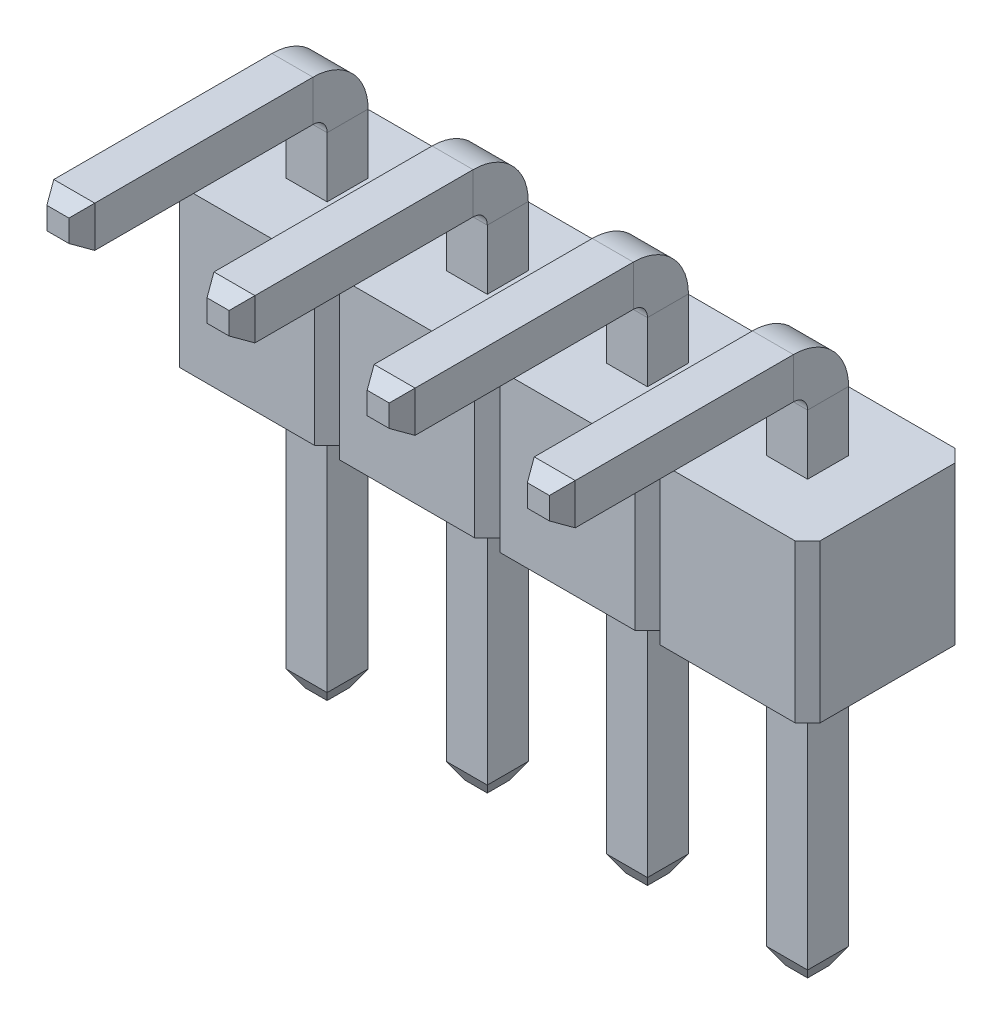
from build123d import *

# Parameters (mm, degrees)
BOSS_EXTRUDE1_DEPTH = 2.5
SKETCH3_W           = 0.65
SKETCH3_H           = 0.65
BOSS_EXTRUDE2_DEPTH = 6
SKETCH4_W           = 0.65
SKETCH4_H           = 0.65
CHAMFER3_SIZE       = 0.15
CHAMFER3_SIZE2      = 0.259807621
CHAMFER2_SIZE       = 0.15
CHAMFER2_SIZE2      = 0.259807621
LPATTERN2_START     = -5.08
LPATTERN2_OUTLINE_W = 2.5
LPATTERN2_OUTLINE_H = 2.54
LPATTERN2_DEPTH     = 7.62
LPATTERN2_START_2   = -4.135
LPATTERN2_2_DEPTH   = 0.65
LPATTERN2_START_3   = -1.595
LPATTERN2_3_DEPTH   = 0.65
LPATTERN2_START_4   = 0.945
LPATTERN2_4_DEPTH   = 0.65
LPATTERN2_START_5   = -4.240192379
LPATTERN2_5_DEPTH   = 9.240192379
LPATTERN2_START_6   = -1
LPATTERN2_6_DEPTH   = 2


with BuildPart() as part:
    # Sketch1 → Boss-Extrude1 (new body)
    with BuildSketch(Plane(origin=(0, 0, 0), x_dir=(1, 0, 0), z_dir=(0, 1, 0))):
        Polygon((-7.42, 1.27), (-7.62, 1.07), (-7.62, -1.07), (-7.42, -1.27), (-5.28, -1.27), (-5.08, -1.07), (-5.08, 1.07), (-5.28, 1.27), align=None)
    extrude(amount=BOSS_EXTRUDE1_DEPTH)

    # Sketch3 → Boss-Extrude2 (add)
    with BuildSketch(Plane(origin=(0, -4.5, 0), x_dir=(1, 0, 0), z_dir=(0, 1, 0))):
        with Locations((-6.35, 0)):
            Rectangle(SKETCH3_W, SKETCH3_H)
    extrude(amount=BOSS_EXTRUDE2_DEPTH)

    # Sweep1: sweep along a path in Sketch5
    with BuildLine(Plane.ZY.offset(6.35)) as sweep1_path:
        Line((0, 2.5), (0, 3.45))
        ThreePointArc((0, 3.45), (0.16109127, 3.83890873), (0.55, 4))
        Line((0.55, 4), (4.27, 4))
    # Sketch4 → Sweep1 (sweep)
    with BuildSketch(Plane(origin=(0, 2.5, 0), x_dir=(1, 0, 0), z_dir=(0, 1, 0))):
        with Locations((-6.35, 0)):
            Rectangle(SKETCH4_W, SKETCH4_H)
    sweep(path=sweep1_path.line)

    # Chamfer3
    chamfer3_edges = [part.edges().sort_by_distance(p)[0] for p in [
        (-6.675, 4, 4.27),
        (-6.35, 3.675, 4.27),
        (-6.025, 4, 4.27),
        (-6.35, 4.325, 4.27),
    ]]
    chamfer3_side = [part.faces().sort_by_distance(p)[0] for p in [
        (-6.35, 4, 4.27),
    ]]
    chamfer(chamfer3_edges, length=CHAMFER3_SIZE, length2=CHAMFER3_SIZE2, reference=chamfer3_side[0])

    # Chamfer2
    chamfer2_edges = [part.edges().sort_by_distance(p)[0] for p in [
        (-6.025, -4.5, 0),
        (-6.35, -4.5, -0.325),
        (-6.675, -4.5, 0),
        (-6.35, -4.5, 0.325),
    ]]
    chamfer2_side = [part.faces().sort_by_distance(p)[0] for p in [
        (-6.35, -4.5, 0),
    ]]
    chamfer(chamfer2_edges, length=CHAMFER2_SIZE, length2=CHAMFER2_SIZE2, reference=chamfer2_side[0])

    # LPattern2: read off the stored shape, not the designer's step
    # LPattern2 outline → LPattern2 (add)
    with BuildSketch(Plane.YZ.offset(LPATTERN2_START)):
        with Locations((1.25, 0)):
            Rectangle(LPATTERN2_OUTLINE_W, LPATTERN2_OUTLINE_H)
    extrude(amount=LPATTERN2_DEPTH)

    # LPattern2 2 outline → LPattern2 2 (add)
    with BuildSketch(Plane.YZ.offset(LPATTERN2_START_2)):
        Polygon((0, -0.325), (0, 0.325), (-4.240192379, 0.325), (-4.5, 0.175), (-4.5, -0.175), (-4.240192379, -0.325), align=None)
        with BuildLine():
            Line((3.45, 0.325), (2.5, 0.325))
            Line((2.5, 0.325), (2.5, -0.325))
            Line((2.5, -0.325), (3.45, -0.325))
            ThreePointArc((3.45, -0.325), (4.068718434, -0.068718434), (4.325, 0.55))
            Line((4.325, 0.55), (4.325, 4.010192379))
            Line((4.325, 4.010192379), (4.175, 4.27))
            Line((4.175, 4.27), (3.825, 4.27))
            Line((3.825, 4.27), (3.675, 4.010192379))
            Line((3.675, 4.010192379), (3.675, 0.55))
            ThreePointArc((3.675, 0.55), (3.609099026, 0.390900974), (3.45, 0.325))
        make_face()
    extrude(amount=LPATTERN2_2_DEPTH)

    # LPattern2 3 outline → LPattern2 3 (add)
    with BuildSketch(Plane.YZ.offset(LPATTERN2_START_3)):
        Polygon((0, -0.325), (0, 0.325), (-4.240192379, 0.325), (-4.5, 0.175), (-4.5, -0.175), (-4.240192379, -0.325), align=None)
        with BuildLine():
            Line((3.45, 0.325), (2.5, 0.325))
            Line((2.5, 0.325), (2.5, -0.325))
            Line((2.5, -0.325), (3.45, -0.325))
            ThreePointArc((3.45, -0.325), (4.068718434, -0.068718434), (4.325, 0.55))
            Line((4.325, 0.55), (4.325, 4.010192379))
            Line((4.325, 4.010192379), (4.175, 4.27))
            Line((4.175, 4.27), (3.825, 4.27))
            Line((3.825, 4.27), (3.675, 4.010192379))
            Line((3.675, 4.010192379), (3.675, 0.55))
            ThreePointArc((3.675, 0.55), (3.609099026, 0.390900974), (3.45, 0.325))
        make_face()
    extrude(amount=LPATTERN2_3_DEPTH)

    # LPattern2 4 outline → LPattern2 4 (add)
    with BuildSketch(Plane.YZ.offset(LPATTERN2_START_4)):
        Polygon((0, -0.325), (0, 0.325), (-4.240192379, 0.325), (-4.5, 0.175), (-4.5, -0.175), (-4.240192379, -0.325), align=None)
        with BuildLine():
            Line((3.45, 0.325), (2.5, 0.325))
            Line((2.5, 0.325), (2.5, -0.325))
            Line((2.5, -0.325), (3.45, -0.325))
            ThreePointArc((3.45, -0.325), (4.068718434, -0.068718434), (4.325, 0.55))
            Line((4.325, 0.55), (4.325, 4.010192379))
            Line((4.325, 4.010192379), (4.175, 4.27))
            Line((4.175, 4.27), (3.825, 4.27))
            Line((3.825, 4.27), (3.675, 4.010192379))
            Line((3.675, 4.010192379), (3.675, 0.55))
            ThreePointArc((3.675, 0.55), (3.609099026, 0.390900974), (3.45, 0.325))
        make_face()
    extrude(amount=LPATTERN2_4_DEPTH)

    # LPattern2 5 outline → LPattern2 5 (cut)
    with BuildSketch(Plane(origin=(0, 0, 0), x_dir=(1, 0, 0), z_dir=(0, 1, 0)).offset(LPATTERN2_START_5)):
        Polygon((-5.08, 1.27), (-5.08, 1.07), (-4.88, 1.27), align=None)
        Polygon((-5.08, -1.27), (-4.88, -1.27), (-5.08, -1.07), align=None)
        Polygon((-2.74, -1.27), (-2.34, -1.27), (-2.54, -1.07), align=None)
        Polygon((-0.2, -1.27), (0.2, -1.27), (0, -1.07), align=None)
        Polygon((2.54, -1.27), (2.54, -1.07), (2.34, -1.27), align=None)
        Polygon((2.54, 1.27), (2.34, 1.27), (2.54, 1.07), align=None)
        Polygon((0.2, 1.27), (-0.2, 1.27), (0, 1.07), align=None)
        Polygon((-2.34, 1.27), (-2.74, 1.27), (-2.54, 1.07), align=None)
        Polygon((1.595, -4.27), (1.595, -4.010192379), (1.445, -4.27), align=None)
        Polygon((1.095, -4.27), (0.945, -4.010192379), (0.945, -4.27), align=None)
        Polygon((-0.945, -4.27), (-0.945, -4.010192379), (-1.095, -4.27), align=None)
        Polygon((-1.445, -4.27), (-1.595, -4.010192379), (-1.595, -4.27), align=None)
        Polygon((-3.485, -4.27), (-3.485, -4.010192379), (-3.635, -4.27), align=None)
        Polygon((-3.985, -4.27), (-4.135, -4.010192379), (-4.135, -4.27), align=None)
    extrude(amount=LPATTERN2_5_DEPTH, mode=Mode.SUBTRACT)

    # LPattern2 6 outline → LPattern2 6 (cut)
    with BuildSketch(Plane.XY.offset(LPATTERN2_START_6)):
        Polygon((-3.485, -4.5), (-3.485, -4.240192379), (-3.635, -4.5), align=None)
        Polygon((-4.135, -4.5), (-3.985, -4.5), (-4.135, -4.240192379), align=None)
        Polygon((-0.945, -4.5), (-0.945, -4.240192379), (-1.095, -4.5), align=None)
        Polygon((-1.595, -4.5), (-1.445, -4.5), (-1.595, -4.240192379), align=None)
        Polygon((1.595, -4.5), (1.595, -4.240192379), (1.445, -4.5), align=None)
        Polygon((0.945, -4.5), (1.095, -4.5), (0.945, -4.240192379), align=None)
    extrude(amount=LPATTERN2_6_DEPTH, mode=Mode.SUBTRACT)


solid = part.part
